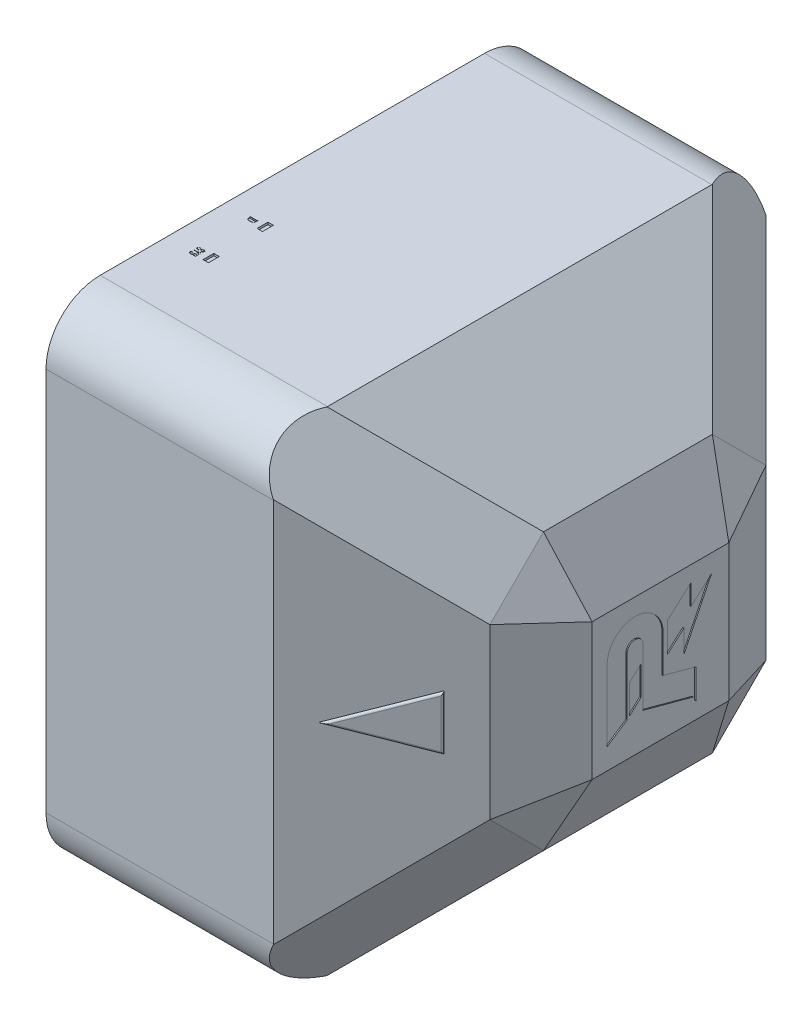
from build123d import *
from OCP.BRepFilletAPI import BRepFilletAPI_MakeChamfer

# Parameters (mm, degrees)
SKETCH_1_W                   = 45.5
SKETCH_1_H                   = 45.5
EXTRUDE_1_DEPTH              = 31
CHAMFER_1_SIZE               = 10
FILLET_2_R                   = 5
SKETCH_4_W                   = 25.5
SKETCH_4_H                   = 25.5
EXTRUDE_2_DEPTH              = 3
CHAMFER_3_SIZE               = 6.433520762
CHAMFER_3_SIZE_2             = 3
EXTRUDE_3_DEPTH              = 0.2
FILLET_3_R                   = 0.2
SKETCH_8_W                   = 157.609807388
SKETCH_8_H                   = 107.838289265
CUT_EXTRUDE_1_DEPTH          = 14.5
MIRROR_2_COPY_1_SKETCH_W     = 157.609807388
MIRROR_2_COPY_1_SKETCH_H     = 107.838289265
MIRROR_2_COPY_1_DEPTH        = 14.5
SKETCH_10_W                  = 27.905803084
SKETCH_10_H                  = 23.134031561
CUT_EXTRUDE_2_DEPTH          = 14.5
MIRROR_4_COPY_1_SKETCH_W     = 27.905803084
MIRROR_4_COPY_1_SKETCH_H     = 23.134031561
MIRROR_4_COPY_1_DEPTH        = 14.5
CUT_EXTRUDE_3_DEPTH          = 0.1
HOLE_WIZARD_M3_1_D           = 2.5
HOLE_WIZARD_M3_1_DEPTH       = 5.5
HOLE_WIZARD_M3_1_CSINK_D     = 3.05
HOLE_WIZARD_M3_1_CSINK_ANGLE = 90
HOLE_WIZARD_M3_1_TIP         = 0.751075774
SKETCH_20_R                  = 3.25
EXTRUDE_4_DEPTH              = 9.1
SKETCH_21_W                  = 0.5
SKETCH_21_H                  = 1
CUT_EXTRUDE_4_DEPTH          = 0.2
CUT_EXTRUDE_5_DEPTH          = 0.2


with BuildPart() as part:
    # 草图1 → 凸台-拉伸1 (new body)
    with BuildSketch(Plane(origin=(0, 0, 0), x_dir=(0, 0, -1), z_dir=(1, 0, 0))):
        Rectangle(SKETCH_1_W, SKETCH_1_H)
    extrude(amount=EXTRUDE_1_DEPTH)

    # 倒角1
    chamfer_1_edges = [part.edges().sort_by_distance(p)[0] for p in [
        (31, 0, -22.75),
        (31, 22.75, 0),
        (31, 0, 22.75),
        (31, -22.75, 0),
    ]]
    chamfer(chamfer_1_edges, length=CHAMFER_1_SIZE)

    # 圆角2
    fillet_2_edges = [part.edges().sort_by_distance(p)[0] for p in [
        (10.5, 22.75, 22.75),
        (10.5, 22.75, -22.75),
        (10.5, -22.75, -22.75),
        (10.5, -22.75, 22.75),
    ]]
    fillet(fillet_2_edges, radius=FILLET_2_R)

    # 草图4 → 凸台-拉伸2 (add)
    with BuildSketch(Plane(origin=(31, 0, 0), x_dir=(0, 0, -1), z_dir=(1, 0, 0))):
        Rectangle(SKETCH_4_W, SKETCH_4_H)
    extrude(amount=EXTRUDE_2_DEPTH)

    # 倒角3
    chamfer_3_edges_1 = [part.edges().sort_by_distance(p)[0] for p in [
        (34, 12.75, 0),
    ]]
    chamfer_3_side_1 = [part.faces().sort_by_distance(p)[0] for p in [
        (34, 12.69, 0),
    ]]
    chamfer_3_edges_2 = [part.edges().sort_by_distance(p)[0] for p in [
        (34, 0, 12.75),
    ]]
    chamfer_3_side_2 = [part.faces().sort_by_distance(p)[0] for p in [
        (33.94, 0, 12.75),
    ]]
    chamfer_3_edges_3 = [part.edges().sort_by_distance(p)[0] for p in [
        (34, -12.75, 0),
    ]]
    chamfer_3_side_3 = [part.faces().sort_by_distance(p)[0] for p in [
        (33.94, -12.75, 0),
    ]]
    chamfer_3_edges_4 = [part.edges().sort_by_distance(p)[0] for p in [
        (34, 0, -12.75),
    ]]
    chamfer_3_side_4 = [part.faces().sort_by_distance(p)[0] for p in [
        (33.94, 0, -12.75),
    ]]
    chamfer_3 = BRepFilletAPI_MakeChamfer(part.part.solid().wrapped)
    for e in chamfer_3_edges_1:
        chamfer_3.Add(CHAMFER_3_SIZE - 0.0001, CHAMFER_3_SIZE_2 - 0.0001, e.wrapped, chamfer_3_side_1[0].wrapped)
    for e in chamfer_3_edges_2:
        chamfer_3.Add(CHAMFER_3_SIZE_2 - 0.0001, CHAMFER_3_SIZE - 0.0001, e.wrapped, chamfer_3_side_2[0].wrapped)
    for e in chamfer_3_edges_3:
        chamfer_3.Add(CHAMFER_3_SIZE_2 - 0.0001, CHAMFER_3_SIZE - 0.0001, e.wrapped, chamfer_3_side_3[0].wrapped)
    for e in chamfer_3_edges_4:
        chamfer_3.Add(CHAMFER_3_SIZE_2 - 0.0001, CHAMFER_3_SIZE - 0.0001, e.wrapped, chamfer_3_side_4[0].wrapped)
    add(Compound.cast(chamfer_3.Shape()), mode=Mode.REPLACE)  # a hair under: the kernel refuses the full size

    # 草图5 → 凸台-拉伸3 (add)
    with BuildSketch(Plane(origin=(21.875, 0, 21.875), x_dir=(0.7071067811865487, 0, -0.7071067811865465), z_dir=(0.7071067811865465, 0, 0.7071067811865487))):
        Polygon((1.762563133, 0), (9.904698757, 2.5), (9.904698757, -2.5), align=None)
    extrude(amount=EXTRUDE_3_DEPTH)

    # 圆角3
    fillet_3_edges = [part.edges().sort_by_distance(p)[0] for p in [
        (26.141421356, -1.25, 17.891421356),
        (29.020101013, 0, 15.0127417),
        (26.141421356, 1.25, 17.891421356),
    ]]
    fillet(fillet_3_edges, radius=FILLET_3_R - 0.0001)  # a hair under: the kernel refuses the full size

    # 草图8 → 切除-拉伸1 (cut)
    with BuildSketch(Plane(origin=(27.516463439, -13.758575727, -13.758575727), x_dir=(-0.36515263225793426, 0.1825808812216835, -0.9128678858232528), z_dir=(0.8164897757687053, -0.40825509553780787, -0.40825509553780787))):
        with Locations((-4.659273719, 7.688764215)):
            Rectangle(SKETCH_8_W, SKETCH_8_H)
    cut_extrude_1 = extrude(amount=CUT_EXTRUDE_1_DEPTH, mode=Mode.SUBTRACT)

    # 镜向1: 切除-拉伸1 across plane
    add(cut_extrude_1.mirror(Plane.XY), mode=Mode.SUBTRACT)

    # 镜向2: 切除-拉伸1 across plane
    add(cut_extrude_1.mirror(Plane.ZX), mode=Mode.SUBTRACT)

    # 镜向2 copy 1 sketch → 镜向2 copy 1 (cut)
    with BuildSketch(Plane(origin=(27.516463439, 13.758575727, 13.758575727), x_dir=(-0.36515263225793426, -0.1825808812216835, 0.9128678858232528), z_dir=(0.8164897757687053, 0.40825509553780787, 0.40825509553780787))):
        with Locations((-4.659273719, 7.688764215)):
            Rectangle(MIRROR_2_COPY_1_SKETCH_W, MIRROR_2_COPY_1_SKETCH_H)
    extrude(amount=MIRROR_2_COPY_1_DEPTH, mode=Mode.SUBTRACT)

    # 草图10 → 切除-拉伸2 (cut)
    with BuildSketch(Plane(origin=(30.133741294, -11.418197083, 11.418197083), x_dir=(-0.3123171306988256, 0.11834237627364355, 0.9425778969665902), z_dir=(-0.8814228177781198, 0.3339863891688393, -0.33398638916884016))):
        with Locations((-1.477762401, 1.929310438)):
            Rectangle(SKETCH_10_W, SKETCH_10_H)
    cut_extrude_2 = extrude(amount=-CUT_EXTRUDE_2_DEPTH, mode=Mode.SUBTRACT)

    # 镜向3: 切除-拉伸2 across plane
    add(cut_extrude_2.mirror(Plane.ZX), mode=Mode.SUBTRACT)

    # 镜向4: 切除-拉伸2 across plane
    add(cut_extrude_2.mirror(Plane.XY), mode=Mode.SUBTRACT)

    # 镜向4 copy 1 sketch → 镜向4 copy 1 (cut)
    with BuildSketch(Plane(origin=(30.133741294, 11.418197083, -11.418197083), x_dir=(-0.3123171306988256, -0.11834237627364355, -0.9425778969665902), z_dir=(-0.8814228177781198, -0.3339863891688393, 0.33398638916884016))):
        with Locations((-1.477762401, 1.929310438)):
            Rectangle(MIRROR_4_COPY_1_SKETCH_W, MIRROR_4_COPY_1_SKETCH_H)
    extrude(amount=-MIRROR_4_COPY_1_DEPTH, mode=Mode.SUBTRACT)

    # 草图11 → 切除-拉伸3 (cut)
    with BuildSketch(Plane(origin=(34, 0, 0), x_dir=(0, 0, -1), z_dir=(1, 0, 0))):
        with BuildLine():
            Line((-4.925215328, -4.378625574), (-4.925215328, 2.279096456))
            ThreePointArc((-4.925215328, 2.279096456), (-2.338177458, 4.744121726), (0.248860411, 2.279096456))
            Line((0.248860411, 2.279096456), (0.248860411, -1.263950595))
            Line((0.248860411, -1.263950595), (3.267476018, -2.084056164))
            Line((3.267476018, -2.084056164), (3.267476018, -4.840354587))
            Line((3.267476018, -4.840354587), (3.049120497, -4.378625574))
            Line((3.049120497, -4.378625574), (-1.598250011, -3.125728943))
            Line((-1.598250011, -3.125728943), (-1.598250011, 2.279096456))
            ThreePointArc((-1.598250011, 2.279096456), (-2.33236169, 2.893939336), (-3.066473369, 2.279096456))
            Line((-3.066473369, 2.279096456), (-3.066473369, -3.147392981))
            Line((-3.066473369, -3.147392981), (-4.925215328, -4.378625574))
        make_face()
        Polygon((-2.866473369, -0.301587617), (-1.798250011, 0.67366098), (-1.798250011, -1.978270376), (-2.866473369, -2.963021262), align=None)
        Polygon((0.648860411, 2.942017279), (2.824503677, 4.871490664), (2.824503677, 2.964488641), (4.715398737, 4.641432537), (2.159802388, -0.559127223), (2.159802388, 1.561123214), (0.648860411, 0.221141437), align=None)
    extrude(amount=-CUT_EXTRUDE_3_DEPTH, mode=Mode.SUBTRACT)

    # M3 螺纹孔1
    with Locations(Plane.ZY):
        with Locations((0, -19), (0, 19)):
            CounterSinkHole(HOLE_WIZARD_M3_1_D / 2, HOLE_WIZARD_M3_1_CSINK_D / 2, depth=HOLE_WIZARD_M3_1_DEPTH, counter_sink_angle=HOLE_WIZARD_M3_1_CSINK_ANGLE)
            with Locations((0, 0, -(HOLE_WIZARD_M3_1_DEPTH + HOLE_WIZARD_M3_1_TIP / 2))):  # 118° drill point
                Cone(0, HOLE_WIZARD_M3_1_D / 2, HOLE_WIZARD_M3_1_TIP, mode=Mode.SUBTRACT)

    # 草图20 → 凸台-拉伸4 (add)
    with BuildSketch(Plane(origin=(0, 0, -22.75), x_dir=(-1, 0, 0), z_dir=(0, 0, -1))):
        with Locations(Location((-5, -7.75, 0), (0, 0, 270))):
            Circle(SKETCH_20_R)
    extrude(amount=EXTRUDE_4_DEPTH)

    # 草图21 → 切除-拉伸4 (cut)
    with BuildSketch(Plane(origin=(0, 22.75, 0), x_dir=(1, 0, 0), z_dir=(0, 1, 0))):
        with Locations((3.75, -6.25)):
            Rectangle(SKETCH_21_W, SKETCH_21_H)
        with Locations((3.75, -11.25)):
            Rectangle(SKETCH_21_W, SKETCH_21_H)
    extrude(amount=-CUT_EXTRUDE_4_DEPTH, mode=Mode.SUBTRACT)

    # 草图22 → 切除-拉伸5 (cut)
    # profile 1 of 5: a face of its own
    with BuildSketch(Plane(origin=(0, 22.75, 0), x_dir=(1, 0, 0), z_dir=(0, 1, 0))):
        with BuildLine():
            Line((2.93484563, -6.106576317), (2.943944288, -6.114630866))
            Line((2.943944288, -6.114630866), (2.884430118, -6.158930888))
            add(Edge.make_bspline(
                [(2.884430118, -6.158930888), (2.881037484, -6.158025032), (2.874772611, -6.15635227), (2.865746295, -6.153311959), (2.856238428, -6.150692383), (2.846985644, -6.149033977), (2.837463067, -6.147916073), (2.827714758, -6.147137082), (2.81561838, -6.14698253), (2.806767983, -6.146896137), (2.801945566, -6.146849064)],
                knots=[0, 0, 0, 0, 1.004386526, 1.854711245, 2.724331898, 3.823662193, 4.540041316, 5.46743207, 6.620050771, 8, 8, 8, 8], degree=3))
            Line((2.801945566, -6.146849064), (2.360884411, -6.146849064))
            Line((2.360884411, -6.146849064), (2.277355751, -6.143865897))
            add(Edge.make_bspline(
                [(2.277355751, -6.143865897), (2.272713654, -6.143794176), (2.264226473, -6.143663048), (2.254500699, -6.142016154), (2.248285779, -6.140312055), (2.245690884, -6.139285585), (2.243694215, -6.138149178), (2.243979488, -6.13722474), (2.244093446, -6.136855456)],
                knots=[0, 0, 0, 0, 2.350389122, 4.297234295, 5.032515409, 5.553050425, 5.821457962, 6, 6, 6, 6], degree=3))
            add(Edge.make_bspline(
                [(2.244093446, -6.136855456), (2.244224838, -6.136401913), (2.244536811, -6.135325036), (2.245858279, -6.133222911), (2.249728179, -6.131233242), (2.253125524, -6.130292518), (2.25528032, -6.129695857)],
                knots=[0, 0, 0, 0, 0.404453484, 0.96032163, 2.07205792, 4, 4, 4, 4], degree=3))
            Line((2.25528032, -6.129695857), (2.268257094, -6.124773632))
            Line((2.268257094, -6.124773632), (2.304502566, -6.113586758))
            add(Edge.make_bspline(
                [(2.304502566, -6.113586758), (2.307989172, -6.112470585), (2.314064566, -6.11052566), (2.321811796, -6.107701112), (2.327129489, -6.106578367), (2.331188768, -6.105877435), (2.335331644, -6.107216866), (2.340885134, -6.109388364), (2.348479222, -6.111917095), (2.357584509, -6.114327339), (2.367172002, -6.116200692), (2.376296577, -6.11792294), (2.384857894, -6.118411624), (2.392487621, -6.119364596), (2.401060208, -6.119399899), (2.412093734, -6.119591265), (2.427757163, -6.119744829), (2.439739567, -6.119717609), (2.446501287, -6.119702249)],
                knots=[0, 0, 0, 0, 1.215038507, 2.117198325, 2.725332732, 3.023985843, 3.464003513, 4.131812171, 5.018312789, 6.110293382, 7.255156699, 8.258226102, 9.185359806, 10.09606967, 10.805346847, 12.02574486, 13.757311121, 16, 16, 16, 16], degree=3))
            Line((2.446501287, -6.119702249), (2.815966448, -6.119702249))
            add(Edge.make_bspline(
                [(2.815966448, -6.119702249), (2.823425235, -6.119596512), (2.837703904, -6.119394096), (2.858211795, -6.118417073), (2.876760501, -6.116593685), (2.89307215, -6.114451338), (2.906424135, -6.112031844), (2.914357506, -6.111026291), (2.917692423, -6.110603592)],
                knots=[0, 0, 0, 0, 1.312964259, 2.513462521, 3.612409855, 4.592638625, 5.408393546, 6, 6, 6, 6], degree=3))
            Line((2.917692423, -6.110603592), (2.93484563, -6.106576317))
        make_face()
    # profile 2 of 5: a face of its own
    with BuildSketch(Plane(origin=(0, 22.75, 0), x_dir=(1, 0, 0), z_dir=(0, 1, 0))):
        with BuildLine():
            add(Edge.make_bspline(
                [(2.85131697, -6.253348105), (2.852469794, -6.250663606), (2.854435886, -6.246085308), (2.857188713, -6.241937784), (2.858327411, -6.240222172)],
                knots=[0, 0, 0, 0, 1.172705823, 2, 2, 2, 2], degree=3))
            Line((2.858327411, -6.240222172), (2.873392402, -6.222174016))
            add(Edge.make_bspline(
                [(2.873392402, -6.222174016), (2.87468464, -6.220384849), (2.87701042, -6.217164696), (2.881569809, -6.214037731), (2.885926941, -6.212508136), (2.889939858, -6.21287928), (2.893388994, -6.214307868), (2.894882929, -6.216181837), (2.895616992, -6.217102633)],
                knots=[0, 0, 0, 0, 1.450223138, 2.610121288, 3.609889734, 4.435660089, 5.231343656, 6, 6, 6, 6], degree=3))
            Line((2.895616992, -6.217102633), (2.892484667, -6.235299948))
            Line((2.892484667, -6.235299948), (2.892484667, -6.256331271))
            add(Edge.make_bspline(
                [(2.892484667, -6.256331271), (2.89253281, -6.256679559), (2.892733195, -6.258129232), (2.893367298, -6.26135586), (2.894426853, -6.266712478), (2.895179743, -6.270996495), (2.895616992, -6.273484478)],
                knots=[0, 0, 0, 0, 0.241932977, 1.006992227, 2.261782692, 4, 4, 4, 4], degree=3))
            Line((2.895616992, -6.273484478), (2.89755605, -6.29466496))
            Line((2.89755605, -6.29466496), (2.908593765, -6.33284949))
            add(Edge.make_bspline(
                [(2.908593765, -6.33284949), (2.909382726, -6.336022501), (2.911035933, -6.342671305), (2.912738742, -6.353296978), (2.914133918, -6.364887211), (2.914513102, -6.372968822), (2.914709257, -6.377149511)],
                knots=[0, 0, 0, 0, 0.875268756, 1.834059148, 2.879539399, 4, 4, 4, 4], degree=3))
            add(Edge.make_bspline(
                [(2.914709257, -6.377149511), (2.914665473, -6.381378439), (2.914581916, -6.389448827), (2.913581, -6.40108436), (2.912419448, -6.411738215), (2.909607896, -6.424331541), (2.904603541, -6.438823829), (2.895030862, -6.454298214), (2.882066431, -6.467623276), (2.869089629, -6.477107286), (2.857064823, -6.48375141), (2.846768501, -6.488544266), (2.835251696, -6.492771051), (2.822689046, -6.496849214), (2.808999993, -6.500419748), (2.794083594, -6.503327606), (2.778028703, -6.506048313), (2.755256764, -6.508897073), (2.726672544, -6.511603274), (2.692677687, -6.513346909), (2.65864323, -6.514072236), (2.630169881, -6.515547739), (2.607742707, -6.516304859), (2.592429317, -6.516766454), (2.578805801, -6.517076046), (2.570253088, -6.517166914), (2.566275419, -6.517209174)],
                knots=[0, 0, 0, 0, 0.718511892, 1.371191541, 1.98438009, 2.538016577, 3.561812734, 4.574950631, 5.603027778, 6.703378005, 7.293539982, 7.936296559, 8.631623701, 9.377255045, 10.180742431, 11.034267383, 11.959536815, 12.947984684, 14.934178762, 16.838298051, 18.732188354, 20.719909964, 21.683887415, 22.546235855, 23.323887817, 24, 24, 24, 24], degree=3))
            add(Edge.make_bspline(
                [(2.566275419, -6.517209174), (2.561849382, -6.517029281), (2.552446351, -6.516647101), (2.537542356, -6.515632429), (2.520973968, -6.514843427), (2.496976726, -6.51326972), (2.466463972, -6.510393115), (2.436389911, -6.505302583), (2.413303887, -6.499491759), (2.39675835, -6.494366293), (2.380982395, -6.488013802), (2.366125946, -6.480838288), (2.352476133, -6.472926815), (2.340186622, -6.464863777), (2.32973093, -6.456230721), (2.320527389, -6.447632341), (2.313172941, -6.438205407), (2.307093404, -6.428274147), (2.302459525, -6.417623252), (2.299114095, -6.405920025), (2.296668393, -6.39255792), (2.294355057, -6.376816923), (2.291771881, -6.358331364), (2.290251171, -6.345034713), (2.289437575, -6.337920873)],
                knots=[0, 0, 0, 0, 0.774260142, 1.64490099, 2.610985761, 3.673537918, 5.848421674, 7.965906422, 8.996634292, 10.008130476, 10.990957312, 11.96657227, 12.889310398, 13.747412069, 14.531944447, 15.257195042, 15.943986578, 16.614698548, 17.287995593, 17.96726769, 18.737664942, 19.660730427, 20.748467454, 22, 22, 22, 22], degree=3))
            Line((2.289437575, -6.337920873), (2.284366193, -6.293620851))
            add(Edge.make_bspline(
                [(2.284366193, -6.293620851), (2.283641799, -6.289379126), (2.282319259, -6.281634926), (2.278147321, -6.273242752), (2.274720941, -6.268261241), (2.272898293, -6.265587547), (2.271789273, -6.26375267), (2.271481667, -6.262748043), (2.271389419, -6.262446762)],
                knots=[0, 0, 0, 0, 2.258427549, 4.123254342, 4.879658115, 5.446960944, 5.834147501, 6, 6, 6, 6], degree=3))
            add(Edge.make_bspline(
                [(2.271389419, -6.262446762), (2.271369862, -6.261583361), (2.271320515, -6.259404671), (2.273638892, -6.256071559), (2.276493967, -6.251599852), (2.280989005, -6.246874951), (2.285596082, -6.242050715), (2.289514172, -6.237666081), (2.292808573, -6.234537869), (2.29475305, -6.232858547), (2.295553067, -6.232167623)],
                knots=[0, 0, 0, 0, 0.515348004, 1.30041936, 2.366493701, 3.781396737, 5.237134932, 6.436223951, 7.356615169, 8, 8, 8, 8], degree=3))
            Line((2.295553067, -6.232167623), (2.30852984, -6.220085799))
            add(Edge.make_bspline(
                [(2.30852984, -6.220085799), (2.309600452, -6.219059423), (2.311520896, -6.217218329), (2.314349026, -6.215197571), (2.316584309, -6.213710013), (2.31903204, -6.213566383), (2.321167064, -6.214249557), (2.323575381, -6.215550227), (2.32432746, -6.219071931), (2.323970676, -6.221607268), (2.323743989, -6.223218124)],
                knots=[0, 0, 0, 0, 1.41993606, 2.547056312, 3.358935816, 3.934013687, 4.826199616, 5.514969776, 6.421106863, 8, 8, 8, 8], degree=3))
            Line((2.323743989, -6.223218124), (2.323743989, -6.237239006))
            Line((2.323743989, -6.237239006), (2.323743989, -6.253348105))
            Line((2.323743989, -6.253348105), (2.85131697, -6.253348105))
        make_face()
        with BuildLine():
            add(Edge.make_bspline(
                [(2.325683047, -6.281539027), (2.325484961, -6.284819772), (2.325115976, -6.290930965), (2.325311042, -6.299436373), (2.325077706, -6.306559773), (2.325497317, -6.310825147), (2.325683047, -6.312713116)],
                knots=[0, 0, 0, 0, 1.263335509, 2.353272607, 3.271114373, 4, 4, 4, 4], degree=3))
            Line((2.325683047, -6.312713116), (2.33075443, -6.357013138))
            add(Edge.make_bspline(
                [(2.33075443, -6.357013138), (2.331353449, -6.362785438), (2.332503392, -6.373866595), (2.334906542, -6.389704453), (2.338421579, -6.403934198), (2.342421878, -6.416909786), (2.348303521, -6.428658307), (2.356754094, -6.438947565), (2.36761024, -6.44802886), (2.384955985, -6.458080931), (2.407815599, -6.467925599), (2.435844722, -6.476464304), (2.464786902, -6.48159072), (2.495826141, -6.485842863), (2.530128605, -6.488679786), (2.568108349, -6.489635322), (2.610080372, -6.489743135), (2.639462797, -6.489267663), (2.654875462, -6.489018252)],
                knots=[0, 0, 0, 0, 0.704581883, 1.352594831, 1.942600025, 2.482797268, 2.998423958, 3.526340836, 4.087447232, 4.707532175, 5.953534875, 7.101189894, 8.256612736, 9.517484019, 10.904522158, 12.432442616, 14.128623977, 16, 16, 16, 16], degree=3))
            add(Edge.make_bspline(
                [(2.654875462, -6.489018252), (2.66064338, -6.488677457), (2.672578605, -6.487972271), (2.691068197, -6.486735099), (2.710807734, -6.485542242), (2.731300223, -6.484423018), (2.751482047, -6.483185978), (2.770104802, -6.480787799), (2.786786066, -6.478453584), (2.801523375, -6.475121198), (2.814734088, -6.471201685), (2.826737185, -6.466671026), (2.837456776, -6.461083088), (2.847171489, -6.45500495), (2.855588931, -6.447964388), (2.862667286, -6.440084198), (2.868207123, -6.43118661), (2.873089878, -6.418731251), (2.87730872, -6.404083292), (2.8788278, -6.392484889), (2.879507893, -6.387292277)],
                knots=[0, 0, 0, 0, 1.134928696, 2.348443086, 3.639933999, 5.019169105, 6.38016582, 7.609686721, 8.70636395, 9.687261883, 10.574043359, 11.411938538, 12.202510425, 12.94479847, 13.658793416, 14.350603059, 15.017278168, 15.704661954, 16.972375805, 18, 18, 18, 18], degree=3))
            add(Edge.make_bspline(
                [(2.879507893, -6.387292277), (2.879621178, -6.383760872), (2.879859161, -6.376342319), (2.878913738, -6.364749736), (2.87769209, -6.352133759), (2.875368051, -6.339146798), (2.873120631, -6.326710357), (2.870976207, -6.315983061), (2.868763042, -6.307517866), (2.867101429, -6.302712141), (2.866381961, -6.300631292)],
                knots=[0, 0, 0, 0, 0.962600417, 2.022170499, 3.167426228, 4.417706313, 5.616892998, 6.613911265, 7.399832243, 8, 8, 8, 8], degree=3))
            Line((2.866381961, -6.300631292), (2.858327411, -6.281539027))
            Line((2.858327411, -6.281539027), (2.325683047, -6.281539027))
        make_face(mode=Mode.SUBTRACT)
    # profile 3 of 5: a face of its own
    with BuildSketch(Plane(origin=(0, 22.75, 0), x_dir=(1, 0, 0), z_dir=(0, 1, 0))):
        with BuildLine():
            Line((2.857283303, -11.141266281), (2.918736531, -11.151409046))
            Line((2.918736531, -11.151409046), (2.917692423, -11.161402654))
            Line((2.917692423, -11.161402654), (2.666062336, -11.161402654))
            Line((2.666062336, -11.161402654), (2.665018227, -11.14932083))
            Line((2.665018227, -11.14932083), (2.771666427, -11.142310389))
            add(Edge.make_bspline(
                [(2.771666427, -11.142310389), (2.777595969, -11.14138502), (2.788556914, -11.139674448), (2.803413074, -11.136356887), (2.815515817, -11.133183238), (2.827914779, -11.128654443), (2.840992859, -11.121408698), (2.855156096, -11.110947985), (2.867740379, -11.098179621), (2.87778147, -11.083238898), (2.885401658, -11.067025215), (2.886853021, -11.055376787), (2.887562442, -11.049683072)],
                knots=[0, 0, 0, 0, 1.116104123, 2.063153488, 2.830567178, 3.442211361, 4.514053799, 5.598078685, 6.709997522, 7.828513521, 8.938584293, 10, 10, 10, 10], degree=3))
            add(Edge.make_bspline(
                [(2.887562442, -11.049683072), (2.887416808, -11.046290566), (2.887117805, -11.039325354), (2.88506429, -11.030579697), (2.882330099, -11.023132872), (2.878869526, -11.016986243), (2.874069489, -11.010328875), (2.868309022, -11.003242338), (2.861575033, -10.996148679), (2.853934197, -10.989658521), (2.845389838, -10.98413745), (2.833171417, -10.978187075), (2.817606102, -10.972221626), (2.801426925, -10.968497272), (2.787938643, -10.966841028), (2.776570305, -10.965488196), (2.763759658, -10.965134201), (2.74994671, -10.96450572), (2.735693152, -10.964787694), (2.721768127, -10.966898918), (2.708514254, -10.970579284), (2.700278392, -10.974301372), (2.696192317, -10.976148019)],
                knots=[0, 0, 0, 0, 0.864256277, 1.774419376, 2.275860491, 2.882827095, 3.565066841, 4.366831751, 5.209533517, 6.055090295, 6.916460278, 7.795097233, 9.516017626, 11.154877947, 12.01175965, 12.980414803, 14.071680427, 15.276446731, 16.506551529, 17.698648785, 18.85822568, 20, 20, 20, 20], degree=3))
            add(Edge.make_bspline(
                [(2.696192317, -10.976148019), (2.692402579, -10.978237321), (2.685012011, -10.982311779), (2.675182656, -10.989938832), (2.667150907, -10.998901323), (2.659181848, -11.011570034), (2.651772484, -11.026563414), (2.64700916, -11.038421088), (2.644881854, -11.043716739)],
                knots=[0, 0, 0, 0, 0.892386811, 1.740290775, 2.554224131, 3.362639231, 4.822151631, 6, 6, 6, 6], degree=3))
            Line((2.644881854, -11.043716739), (2.630711814, -11.078918103))
            add(Edge.make_bspline(
                [(2.630711814, -11.078918103), (2.628708914, -11.083261061), (2.624852457, -11.09162315), (2.6187174, -11.103408806), (2.612650564, -11.114078901), (2.604433726, -11.126356804), (2.593639736, -11.139879776), (2.578762573, -11.153266284), (2.561854395, -11.164066167), (2.542281634, -11.171167251), (2.520854646, -11.176221978), (2.497713183, -11.179951285), (2.472396816, -11.1822414), (2.445329407, -11.183530272), (2.417354963, -11.182781885), (2.399088784, -11.17924734), (2.390119442, -11.177511753)],
                knots=[0, 0, 0, 0, 0.703174141, 1.35391705, 1.953350921, 2.506934241, 3.52548439, 4.488463203, 5.437829236, 6.45616944, 7.532539377, 8.673212565, 9.89978345, 11.268238982, 12.658608556, 14, 14, 14, 14], degree=3))
            add(Edge.make_bspline(
                [(2.390119442, -11.177511753), (2.381124113, -11.175316755), (2.363700706, -11.171065179), (2.343691409, -11.161852964), (2.329522847, -11.153805772), (2.320410923, -11.147796956), (2.312432578, -11.142001448), (2.303192917, -11.134152622), (2.293567567, -11.122023985), (2.285678365, -11.108055665), (2.280853941, -11.095107833), (2.27813776, -11.084312051), (2.276714462, -11.072740857), (2.276448387, -11.064801216), (2.276311643, -11.060720787)],
                knots=[0, 0, 0, 0, 1.868003723, 3.618209874, 4.428549287, 5.161723048, 5.823107882, 6.421629236, 7.606883146, 8.929691001, 9.648462166, 10.394407926, 11.174836076, 12, 12, 12, 12], degree=3))
            add(Edge.make_bspline(
                [(2.276311643, -11.060720787), (2.276342494, -11.056139557), (2.276402879, -11.047172675), (2.27849353, -11.034091012), (2.282440873, -11.02178113), (2.288168407, -11.010280562), (2.295442135, -10.999496244), (2.303894159, -10.989342953), (2.313767653, -10.980087318), (2.324622407, -10.971316173), (2.336954941, -10.963711115), (2.350181744, -10.956527796), (2.364800602, -10.950875357), (2.385218799, -10.944179493), (2.411182442, -10.938125426), (2.432248168, -10.936610605), (2.442474013, -10.935875273)],
                knots=[0, 0, 0, 0, 0.833854097, 1.6321101, 2.402748685, 3.180594609, 3.964483268, 4.7682714, 5.582003262, 6.426613426, 7.306205384, 8.217956254, 9.165025086, 10.156210307, 12.134125674, 14, 14, 14, 14], degree=3))
            Line((2.442474013, -10.935875273), (2.495872692, -10.931847998))
            Line((2.495872692, -10.931847998), (2.495872692, -10.946018039))
            add(Edge.make_bspline(
                [(2.495872692, -10.946018039), (2.489554051, -10.946833141), (2.47739788, -10.948401282), (2.45986246, -10.951156669), (2.443698082, -10.953812359), (2.424380664, -10.957207759), (2.402556643, -10.962515312), (2.378850866, -10.97089466), (2.357981748, -10.981793229), (2.343430434, -10.993614389), (2.333294801, -11.003661461), (2.327356818, -11.011540428), (2.322363805, -11.019325262), (2.318040394, -11.029883982), (2.314597011, -11.043051464), (2.314629535, -11.05363916), (2.314645332, -11.058781729)],
                knots=[0, 0, 0, 0, 1.134776714, 2.183149769, 3.161555936, 4.052699768, 5.676561861, 7.155795671, 8.522790098, 9.84643787, 10.478963242, 11.059977006, 11.600716688, 12.120527015, 13.087117758, 14, 14, 14, 14], degree=3))
            add(Edge.make_bspline(
                [(2.314645332, -11.058781729), (2.31481792, -11.063269039), (2.315152617, -11.071971201), (2.317698849, -11.084403669), (2.321895181, -11.095734126), (2.327974889, -11.105802044), (2.335540644, -11.114779369), (2.344308039, -11.122872663), (2.354196351, -11.130283478), (2.365293347, -11.136466847), (2.376766737, -11.14191835), (2.388164362, -11.14642312), (2.399322161, -11.149686596), (2.410269337, -11.152178307), (2.421651356, -11.153702299), (2.433767784, -11.154246897), (2.446896137, -11.154883955), (2.455947537, -11.154560841), (2.460671328, -11.154392213)],
                knots=[0, 0, 0, 0, 1.095903634, 2.1252668, 3.086556001, 4.034624865, 4.983549703, 5.946373285, 6.945093537, 7.995466281, 9.044362349, 10.048389491, 10.98636182, 11.882482185, 12.789734906, 13.787863761, 14.845519177, 16, 16, 16, 16], degree=3))
            add(Edge.make_bspline(
                [(2.460671328, -11.154392213), (2.468045528, -11.153877073), (2.481808913, -11.152915602), (2.500712915, -11.149672898), (2.516674752, -11.146068597), (2.529711766, -11.140854066), (2.540593226, -11.134657521), (2.55015201, -11.127869909), (2.558963593, -11.120652534), (2.566503975, -11.112175672), (2.573411356, -11.10279036), (2.579973205, -11.092338073), (2.586143698, -11.080635001), (2.5896597, -11.072236191), (2.591483175, -11.067880387)],
                knots=[0, 0, 0, 0, 1.577820015, 2.944881455, 4.093665166, 5.065907885, 5.931360948, 6.762240305, 7.568595587, 8.35798795, 9.177867226, 10.055934531, 10.991765707, 12, 12, 12, 12], degree=3))
            Line((2.591483175, -11.067880387), (2.607592274, -11.024475315))
            add(Edge.make_bspline(
                [(2.607592274, -11.024475315), (2.610529275, -11.017662443), (2.616315144, -11.004241138), (2.628282294, -10.986055199), (2.642544473, -10.970141584), (2.659947394, -10.957352975), (2.680149116, -10.947415568), (2.699203693, -10.941743342), (2.716169069, -10.938066803), (2.730719975, -10.936653119), (2.746693029, -10.935650921), (2.757792707, -10.935798108), (2.763611878, -10.935875273)],
                knots=[0, 0, 0, 0, 1.148654714, 2.26284086, 3.359793028, 4.445414205, 5.590206664, 6.8339345, 7.518937951, 8.279293139, 9.097894003, 10, 10, 10, 10], degree=3))
            add(Edge.make_bspline(
                [(2.763611878, -10.935875273), (2.768635681, -10.935916295), (2.778347129, -10.935995594), (2.792391356, -10.937059956), (2.805363368, -10.938767798), (2.821116259, -10.942251457), (2.839726355, -10.947789738), (2.860442951, -10.956719833), (2.879097232, -10.966743031), (2.894607983, -10.978557271), (2.906842738, -10.991998467), (2.915189987, -11.00434382), (2.920190561, -11.015449849), (2.922947735, -11.02491955), (2.924296706, -11.035474293), (2.92456424, -11.04286854), (2.924702864, -11.046699905)],
                knots=[0, 0, 0, 0, 0.971438024, 1.877874368, 2.722414438, 3.49949346, 4.996244094, 6.46980092, 7.855884959, 9.08304859, 10.219605673, 11.358479236, 11.948218795, 12.569048444, 13.258545469, 14, 14, 14, 14], degree=3))
            add(Edge.make_bspline(
                [(2.924702864, -11.046699905), (2.924214359, -11.050994801), (2.923242789, -11.059536764), (2.91984619, -11.072064752), (2.914974364, -11.084188302), (2.908341647, -11.095494908), (2.901044181, -11.105919036), (2.893230479, -11.115133095), (2.885112296, -11.122945927), (2.879210982, -11.127159807), (2.876375568, -11.129184457)],
                knots=[0, 0, 0, 0, 1.050083224, 2.088472429, 3.146187677, 4.218663254, 5.26881611, 6.238152715, 7.153482214, 8, 8, 8, 8], degree=3))
            Line((2.876375568, -11.129184457), (2.857283303, -11.141266281))
        make_face()
    # profile 4 of 5: a face of its own
    with BuildSketch(Plane(origin=(0, 22.75, 0), x_dir=(1, 0, 0), z_dir=(0, 1, 0))):
        with BuildLine():
            Line((2.621762314, -11.41049705), (2.349846695, -11.411541158))
            Line((2.349846695, -11.411541158), (2.283471243, -11.409452942))
            add(Edge.make_bspline(
                [(2.283471243, -11.409452942), (2.278537311, -11.409106407), (2.269591926, -11.408478129), (2.259251436, -11.407150854), (2.25263635, -11.405813838), (2.249758059, -11.404611966), (2.24766536, -11.403112688), (2.247981316, -11.401923207), (2.248120721, -11.401398392)],
                knots=[0, 0, 0, 0, 2.331603137, 4.227275097, 4.950443083, 5.465290602, 5.764078906, 6, 6, 6, 6], degree=3))
            add(Edge.make_bspline(
                [(2.248120721, -11.401398392), (2.248257421, -11.400995782), (2.248602729, -11.399978777), (2.249765397, -11.398138399), (2.252427418, -11.396290765), (2.257034799, -11.394619644), (2.264167352, -11.392746559), (2.269897786, -11.39125415), (2.273328477, -11.390360677)],
                knots=[0, 0, 0, 0, 0.268048631, 0.677098845, 1.348504357, 2.263168441, 3.762836928, 6, 6, 6, 6], degree=3))
            Line((2.273328477, -11.390360677), (2.310618057, -11.378278853))
            add(Edge.make_bspline(
                [(2.310618057, -11.378278853), (2.314230426, -11.376918721), (2.320602607, -11.374519464), (2.329122514, -11.372211102), (2.335299247, -11.370693923), (2.338608336, -11.37111138), (2.339853088, -11.371268411)],
                knots=[0, 0, 0, 0, 1.524170777, 2.688621556, 3.506709846, 4, 4, 4, 4], degree=3))
            Line((2.339853088, -11.371268411), (2.349846695, -11.374251578))
            add(Edge.make_bspline(
                [(2.349846695, -11.374251578), (2.350885391, -11.374617504), (2.353369604, -11.375492678), (2.357819378, -11.376473723), (2.363520023, -11.37727977), (2.367696724, -11.377925421), (2.369983069, -11.378278853)],
                knots=[0, 0, 0, 0, 0.641890796, 1.535188493, 2.650751144, 4, 4, 4, 4], degree=3))
            Line((2.369983069, -11.378278853), (2.409211707, -11.383350235))
            add(Edge.make_bspline(
                [(2.409211707, -11.383350235), (2.409510024, -11.383350235), (2.41070329, -11.383350235), (2.413338421, -11.383350235), (2.417763451, -11.383350235), (2.423928661, -11.383350235), (2.431883772, -11.383350235), (2.441529343, -11.383350235), (2.452964815, -11.383350235), (2.461168522, -11.383350235), (2.465593552, -11.383350235)],
                knots=[0, 0, 0, 0, 0.126984127, 0.507936508, 1.121693122, 2.010582011, 3.132275132, 4.507936508, 6.116402116, 8, 8, 8, 8], degree=3))
            Line((2.465593552, -11.383350235), (2.619674098, -11.383350235))
            Line((2.619674098, -11.383350235), (2.823126048, -11.3047438))
            add(Edge.make_bspline(
                [(2.823126048, -11.3047438), (2.827415617, -11.303036072), (2.835429888, -11.299845496), (2.846452391, -11.294901428), (2.856016794, -11.291044798), (2.866456727, -11.286153673), (2.878382024, -11.280249902), (2.891488427, -11.272894947), (2.902644687, -11.266349919), (2.90910129, -11.262150832), (2.91172609, -11.260443779)],
                knots=[0, 0, 0, 0, 1.116341519, 2.085678838, 2.920833507, 3.609414731, 4.872989993, 6.137708763, 7.242923352, 8, 8, 8, 8], degree=3))
            Line((2.91172609, -11.260443779), (2.922763806, -11.25149428))
            Line((2.922763806, -11.25149428), (2.938872905, -11.255521554))
            Line((2.938872905, -11.255521554), (2.917692423, -11.314886566))
            add(Edge.make_bspline(
                [(2.917692423, -11.314886566), (2.91371315, -11.315216126), (2.9064944, -11.315813977), (2.897649312, -11.316772277), (2.890744294, -11.31761982), (2.884581062, -11.318380031), (2.877160047, -11.319232034), (2.865929395, -11.32078651), (2.851849574, -11.323218294), (2.841183537, -11.327071833), (2.836102822, -11.328907448)],
                knots=[0, 0, 0, 0, 1.153733176, 2.092972899, 2.570546522, 3.163948113, 3.887440253, 4.728602165, 6.441685332, 8, 8, 8, 8], degree=3))
            Line((2.836102822, -11.328907448), (2.663974119, -11.398415226))
            Line((2.663974119, -11.398415226), (2.830136489, -11.482987994))
            add(Edge.make_bspline(
                [(2.830136489, -11.482987994), (2.832914799, -11.484293864), (2.838895963, -11.487105148), (2.848777732, -11.491387892), (2.859957624, -11.49669614), (2.872236604, -11.502004225), (2.883973937, -11.507228457), (2.894235838, -11.511013834), (2.902048748, -11.513997032), (2.906691909, -11.514854833), (2.908593765, -11.515206191)],
                knots=[0, 0, 0, 0, 0.867143712, 1.866791998, 3.041945698, 4.362452874, 5.645994259, 6.668468952, 7.454599786, 8, 8, 8, 8], degree=3))
            Line((2.908593765, -11.515206191), (2.940811963, -11.519233466))
            Line((2.940811963, -11.519233466), (2.940811963, -11.529376232))
            Line((2.940811963, -11.529376232), (2.86026647, -11.548468497))
            add(Edge.make_bspline(
                [(2.86026647, -11.548468497), (2.858360705, -11.545907653), (2.854751561, -11.54105792), (2.849699539, -11.535226899), (2.844825778, -11.530640608), (2.839880349, -11.526199793), (2.833155034, -11.521318312), (2.822866315, -11.513875806), (2.810381643, -11.505021241), (2.799718, -11.499592806), (2.794935125, -11.497158034)],
                knots=[0, 0, 0, 0, 0.913641929, 1.730257947, 2.203303721, 2.828477397, 3.631086097, 4.578995307, 6.465604953, 8, 8, 8, 8], degree=3))
            Line((2.794935125, -11.497158034), (2.621762314, -11.41049705))
        make_face()
    # profile 5 of 5: a face of its own
    with BuildSketch(Plane(origin=(0, 22.75, 0), x_dir=(1, 0, 0), z_dir=(0, 1, 0))):
        with BuildLine():
            Line((2.857283303, -11.819041691), (2.918736531, -11.829184457))
            Line((2.918736531, -11.829184457), (2.917692423, -11.839178064))
            Line((2.917692423, -11.839178064), (2.666062336, -11.839178064))
            Line((2.666062336, -11.839178064), (2.665018227, -11.82709624))
            Line((2.665018227, -11.82709624), (2.771666427, -11.820085799))
            add(Edge.make_bspline(
                [(2.771666427, -11.820085799), (2.777595969, -11.819160431), (2.788556914, -11.817449858), (2.803413074, -11.814132298), (2.815515817, -11.810958648), (2.827914779, -11.806429853), (2.840992859, -11.799184108), (2.855156096, -11.788723395), (2.867740379, -11.775955031), (2.87778147, -11.761014309), (2.885401658, -11.744800625), (2.886853021, -11.733152197), (2.887562442, -11.727458482)],
                knots=[0, 0, 0, 0, 1.116104123, 2.063153488, 2.830567178, 3.442211361, 4.514053799, 5.598078685, 6.709997522, 7.828513521, 8.938584293, 10, 10, 10, 10], degree=3))
            add(Edge.make_bspline(
                [(2.887562442, -11.727458482), (2.887416808, -11.724065976), (2.887117805, -11.717100764), (2.88506429, -11.708355107), (2.882330099, -11.700908282), (2.878869526, -11.694761653), (2.874069489, -11.688104286), (2.868309022, -11.681017749), (2.861575033, -11.673924089), (2.853934197, -11.667433931), (2.845389838, -11.661912861), (2.833171417, -11.655962485), (2.817606102, -11.649997036), (2.801426925, -11.646272682), (2.787938643, -11.644616438), (2.776570305, -11.643263607), (2.763759658, -11.642909611), (2.74994671, -11.64228113), (2.735693152, -11.642563104), (2.721768127, -11.644674328), (2.708514254, -11.648354694), (2.700278392, -11.652076782), (2.696192317, -11.65392343)],
                knots=[0, 0, 0, 0, 0.864256277, 1.774419376, 2.275860491, 2.882827095, 3.565066841, 4.366831751, 5.209533517, 6.055090295, 6.916460278, 7.795097233, 9.516017626, 11.154877947, 12.01175965, 12.980414803, 14.071680427, 15.276446731, 16.506551529, 17.698648785, 18.85822568, 20, 20, 20, 20], degree=3))
            add(Edge.make_bspline(
                [(2.696192317, -11.65392343), (2.692402579, -11.656012731), (2.685012011, -11.660087189), (2.675182656, -11.667714242), (2.667150907, -11.676676734), (2.659181848, -11.689345445), (2.651772484, -11.704338824), (2.64700916, -11.716196498), (2.644881854, -11.721492149)],
                knots=[0, 0, 0, 0, 0.892386811, 1.740290775, 2.554224131, 3.362639231, 4.822151631, 6, 6, 6, 6], degree=3))
            Line((2.644881854, -11.721492149), (2.630711814, -11.756693513))
            add(Edge.make_bspline(
                [(2.630711814, -11.756693513), (2.628708914, -11.761036471), (2.624852457, -11.76939856), (2.6187174, -11.781184216), (2.612650564, -11.791854312), (2.604433726, -11.804132214), (2.593639736, -11.817655187), (2.578762573, -11.831041695), (2.561854395, -11.841841577), (2.542281634, -11.848942661), (2.520854646, -11.853997388), (2.497713183, -11.857726695), (2.472396816, -11.86001681), (2.445329407, -11.861305683), (2.417354963, -11.860557295), (2.399088784, -11.85702275), (2.390119442, -11.855287163)],
                knots=[0, 0, 0, 0, 0.703174141, 1.35391705, 1.953350921, 2.506934241, 3.52548439, 4.488463203, 5.437829236, 6.45616944, 7.532539377, 8.673212565, 9.89978345, 11.268238982, 12.658608556, 14, 14, 14, 14], degree=3))
            add(Edge.make_bspline(
                [(2.390119442, -11.855287163), (2.381124113, -11.853092166), (2.363700706, -11.848840589), (2.343691409, -11.839628374), (2.329522847, -11.831581182), (2.320410923, -11.825572366), (2.312432578, -11.819776858), (2.303192917, -11.811928032), (2.293567567, -11.799799395), (2.285678365, -11.785831075), (2.280853941, -11.772883244), (2.27813776, -11.762087461), (2.276714462, -11.750516267), (2.276448387, -11.742576627), (2.276311643, -11.738496198)],
                knots=[0, 0, 0, 0, 1.868003723, 3.618209874, 4.428549287, 5.161723048, 5.823107882, 6.421629236, 7.606883146, 8.929691001, 9.648462166, 10.394407926, 11.174836076, 12, 12, 12, 12], degree=3))
            add(Edge.make_bspline(
                [(2.276311643, -11.738496198), (2.276342494, -11.733914968), (2.276402879, -11.724948085), (2.27849353, -11.711866422), (2.282440873, -11.69955654), (2.288168407, -11.688055972), (2.295442135, -11.677271654), (2.303894159, -11.667118363), (2.313767653, -11.657862728), (2.324622407, -11.649091583), (2.336954941, -11.641486526), (2.350181744, -11.634303206), (2.364800602, -11.628650767), (2.385218799, -11.621954903), (2.411182442, -11.615900836), (2.432248168, -11.614386016), (2.442474013, -11.613650683)],
                knots=[0, 0, 0, 0, 0.833854097, 1.6321101, 2.402748685, 3.180594609, 3.964483268, 4.7682714, 5.582003262, 6.426613426, 7.306205384, 8.217956254, 9.165025086, 10.156210307, 12.134125674, 14, 14, 14, 14], degree=3))
            Line((2.442474013, -11.613650683), (2.495872692, -11.609623408))
            Line((2.495872692, -11.609623408), (2.495872692, -11.623793449))
            add(Edge.make_bspline(
                [(2.495872692, -11.623793449), (2.489554051, -11.624608551), (2.47739788, -11.626176692), (2.45986246, -11.628932079), (2.443698082, -11.631587769), (2.424380664, -11.634983169), (2.402556643, -11.640290723), (2.378850866, -11.64867007), (2.357981748, -11.659568639), (2.343430434, -11.671389799), (2.333294801, -11.681436871), (2.327356818, -11.689315838), (2.322363805, -11.697100673), (2.318040394, -11.707659392), (2.314597011, -11.720826874), (2.314629535, -11.73141457), (2.314645332, -11.736557139)],
                knots=[0, 0, 0, 0, 1.134776714, 2.183149769, 3.161555936, 4.052699768, 5.676561861, 7.155795671, 8.522790098, 9.84643787, 10.478963242, 11.059977006, 11.600716688, 12.120527015, 13.087117758, 14, 14, 14, 14], degree=3))
            add(Edge.make_bspline(
                [(2.314645332, -11.736557139), (2.31481792, -11.741044449), (2.315152617, -11.749746611), (2.317698849, -11.762179079), (2.321895181, -11.773509536), (2.327974889, -11.783577454), (2.335540644, -11.792554779), (2.344308039, -11.800648074), (2.354196351, -11.808058888), (2.365293347, -11.814242257), (2.376766737, -11.819693761), (2.388164362, -11.82419853), (2.399322161, -11.827462006), (2.410269337, -11.829953717), (2.421651356, -11.83147771), (2.433767784, -11.832022308), (2.446896137, -11.832659365), (2.455947537, -11.832336251), (2.460671328, -11.832167623)],
                knots=[0, 0, 0, 0, 1.095903634, 2.1252668, 3.086556001, 4.034624865, 4.983549703, 5.946373285, 6.945093537, 7.995466281, 9.044362349, 10.048389491, 10.98636182, 11.882482185, 12.789734906, 13.787863761, 14.845519177, 16, 16, 16, 16], degree=3))
            add(Edge.make_bspline(
                [(2.460671328, -11.832167623), (2.468045528, -11.831652483), (2.481808913, -11.830691013), (2.500712915, -11.827448308), (2.516674752, -11.823844007), (2.529711766, -11.818629476), (2.540593226, -11.812432931), (2.55015201, -11.805645319), (2.558963593, -11.798427944), (2.566503975, -11.789951082), (2.573411356, -11.780565771), (2.579973205, -11.770113483), (2.586143698, -11.758410411), (2.5896597, -11.750011601), (2.591483175, -11.745655797)],
                knots=[0, 0, 0, 0, 1.577820015, 2.944881455, 4.093665166, 5.065907885, 5.931360948, 6.762240305, 7.568595587, 8.35798795, 9.177867226, 10.055934531, 10.991765707, 12, 12, 12, 12], degree=3))
            Line((2.591483175, -11.745655797), (2.607592274, -11.702250726))
            add(Edge.make_bspline(
                [(2.607592274, -11.702250726), (2.610529275, -11.695437853), (2.616315144, -11.682016548), (2.628282294, -11.663830609), (2.642544473, -11.647916994), (2.659947394, -11.635128385), (2.680149116, -11.625190978), (2.699203693, -11.619518752), (2.716169069, -11.615842213), (2.730719975, -11.614428529), (2.746693029, -11.613426331), (2.757792707, -11.613573518), (2.763611878, -11.613650683)],
                knots=[0, 0, 0, 0, 1.148654714, 2.26284086, 3.359793028, 4.445414205, 5.590206664, 6.8339345, 7.518937951, 8.279293139, 9.097894003, 10, 10, 10, 10], degree=3))
            add(Edge.make_bspline(
                [(2.763611878, -11.613650683), (2.768635681, -11.613691705), (2.778347129, -11.613771005), (2.792391356, -11.614835366), (2.805363368, -11.616543208), (2.821116259, -11.620026867), (2.839726355, -11.625565148), (2.860442951, -11.634495243), (2.879097232, -11.644518441), (2.894607983, -11.656332681), (2.906842738, -11.669773878), (2.915189987, -11.68211923), (2.920190561, -11.693225259), (2.922947735, -11.70269496), (2.924296706, -11.713249703), (2.92456424, -11.72064395), (2.924702864, -11.724475315)],
                knots=[0, 0, 0, 0, 0.971438024, 1.877874368, 2.722414438, 3.49949346, 4.996244094, 6.46980092, 7.855884959, 9.08304859, 10.219605673, 11.358479236, 11.948218795, 12.569048444, 13.258545469, 14, 14, 14, 14], degree=3))
            add(Edge.make_bspline(
                [(2.924702864, -11.724475315), (2.924214359, -11.728770211), (2.923242789, -11.737312174), (2.91984619, -11.749840162), (2.914974364, -11.761963712), (2.908341647, -11.773270318), (2.901044181, -11.783694447), (2.893230479, -11.792908505), (2.885112296, -11.800721338), (2.879210982, -11.804935217), (2.876375568, -11.806959867)],
                knots=[0, 0, 0, 0, 1.050083224, 2.088472429, 3.146187677, 4.218663254, 5.26881611, 6.238152715, 7.153482214, 8, 8, 8, 8], degree=3))
            Line((2.876375568, -11.806959867), (2.857283303, -11.819041691))
        make_face()
    extrude(amount=-CUT_EXTRUDE_5_DEPTH, mode=Mode.SUBTRACT)


solid = part.part
